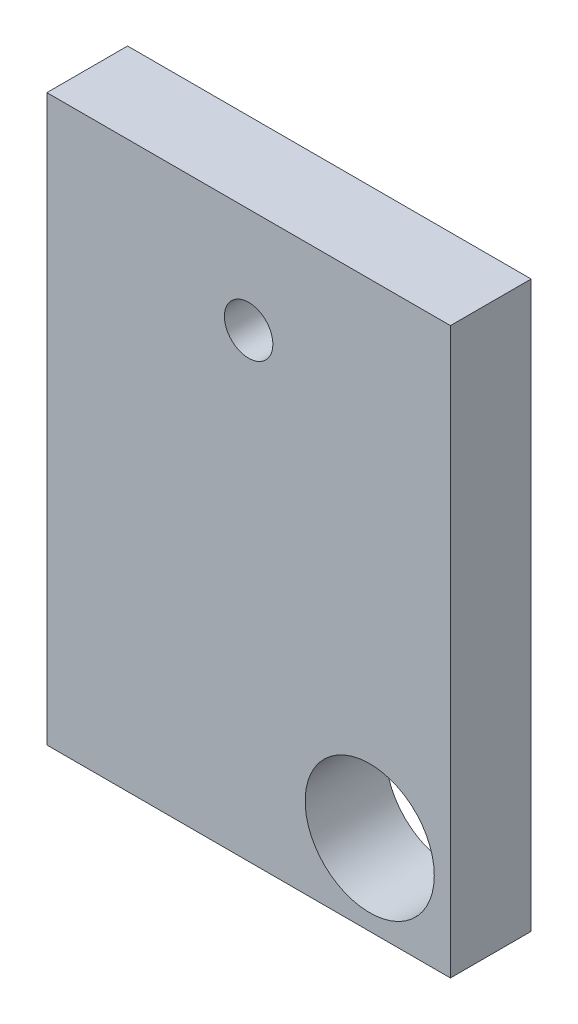
from build123d import *

# Parameters (mm, degrees)
SKETCH2_W           = 25
SKETCH2_H           = 35
BOSS_EXTRUDE1_DEPTH = 5
SKETCH4_R           = 1.5
CUT_EXTRUDE1_DEPTH  = 23.079402166
SKETCH6_R           = 4
CUT_EXTRUDE2_DEPTH  = 23.079402166


with BuildPart() as part:
    # Sketch2 → Boss-Extrude1 (new body)
    with BuildSketch(Plane.XY):
        Rectangle(SKETCH2_W, SKETCH2_H)
    extrude(amount=BOSS_EXTRUDE1_DEPTH)

    # Sketch4 → Cut-Extrude1 (cut, through all)
    with BuildSketch(Plane.XY.offset(5)):
        with Locations((0, 11)):
            Circle(SKETCH4_R)
    extrude(amount=-CUT_EXTRUDE1_DEPTH, mode=Mode.SUBTRACT)

    # Sketch6 → Cut-Extrude2 (cut, through all)
    with BuildSketch(Plane.XY.offset(5)):
        with Locations((7.5, -12.5)):
            Circle(SKETCH6_R)
    extrude(amount=-CUT_EXTRUDE2_DEPTH, mode=Mode.SUBTRACT)


solid = part.part
